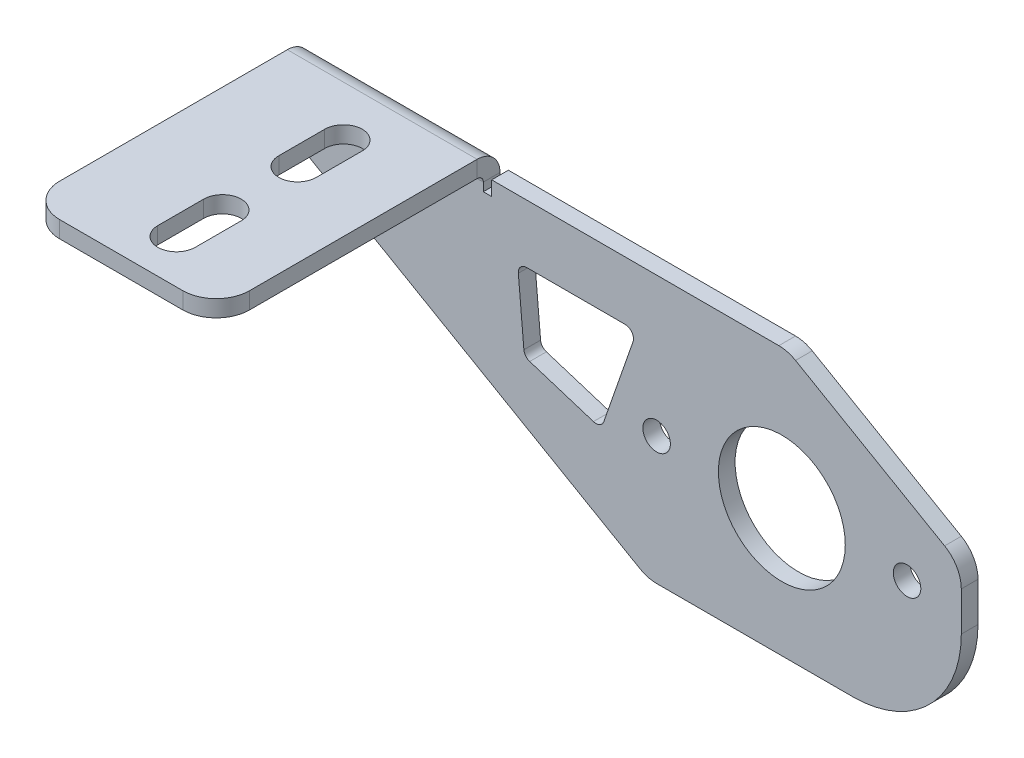
from build123d import *

# Parameters (mm, degrees)
SM_BASE_FLANGE_1_DEPTH            = 2
SKETCH_6_R                        = 7.6
SKETCH_6_R_2                      = 1.65
CUT_EXTRUDE_1_DEPTH               = 10
SM_EDGE_FLANGE_1_STRIP_W          = 9.4732
SM_EDGE_FLANGE_1_STRIP_H          = 2
SM_EDGE_FLANGE_1_STRIP_CUT_DEPTH  = 22.74
SM_EDGE_FLANGE_1_RELIEF_W         = 10.4732
SM_EDGE_FLANGE_1_RELIEF_H         = 1
SM_EDGE_FLANGE_1_RELIEF_CUT_DEPTH = 2
SM_EDGE_FLANGE_1_DEPTH            = 22.74
CUT_EXTRUDE_2_DEPTH               = 10
FILLET_1_R                        = 4
CUT_EXTRUDE_3_DEPTH               = 10
FILLET_2_R                        = 1
FILLET_3_R                        = 13


# Sheet-metal steps are written as plain solids
with BuildPart() as part:
    # Sketch 1 → 基体-法兰1 (new body)
    with BuildSketch(Plane.XY):
        Polygon((0, 0), (0, -7.5), (42.435244785, -32), (80, -32), (80, -12), (59.215390309, 0), align=None)
    extrude(amount=-SM_BASE_FLANGE_1_DEPTH)

    # 草图6 → 切除-拉伸1 (cut)
    with BuildSketch(Plane.XY):
        with Locations((58.5, -16.7)):
            Circle(SKETCH_6_R)
        with Locations((73.5, -16.7)):
            Circle(SKETCH_6_R_2)
        with Locations((43.5, -16.7)):
            Circle(SKETCH_6_R_2)
    extrude(amount=-CUT_EXTRUDE_1_DEPTH, mode=Mode.SUBTRACT)

    # 边线-法兰1 strip (across the edge) → 边线-法兰1 strip cut (cut)
    with BuildSketch(Plane(origin=(22.74, 0, 0), x_dir=(0, -1, 0), z_dir=(-1, 0, 0))):
        with Locations((-4, -1)):
            Rectangle(SM_EDGE_FLANGE_1_STRIP_W, SM_EDGE_FLANGE_1_STRIP_H)
    extrude(amount=SM_EDGE_FLANGE_1_STRIP_CUT_DEPTH, mode=Mode.SUBTRACT)

    # 边线-法兰1 relief (on the sheet) → 边线-法兰1 relief cut (cut)
    with BuildSketch(Plane(origin=(22.74, -0.7366, 0), x_dir=(0, -1, 0), z_dir=(0, 0, 1))):
        with Locations((-4.2366, 0.5)):
            Rectangle(SM_EDGE_FLANGE_1_RELIEF_W, SM_EDGE_FLANGE_1_RELIEF_H)
    extrude(amount=-SM_EDGE_FLANGE_1_RELIEF_CUT_DEPTH, mode=Mode.SUBTRACT)

    # 边线-法兰1 section (across the edge) → 边线-法兰1 (add)
    with BuildSketch(Plane(origin=(22.74, 0, 0), x_dir=(0, -1, 0), z_dir=(-1, 0, 0))):
        with BuildLine():
            Line((-2, 0.7366), (-2, 32))
            Line((-2, 32), (0, 32))
            Line((0, 32), (0, 0.7366))
            ThreePointArc((0, 0.7366), (0.215745145, 0.215745145), (0.7366, 0))
            Line((0.7366, 0), (0.7366, -2))
            ThreePointArc((0.7366, -2), (-1.198468417, -1.198468417), (-2, 0.7366))
        make_face()
    extrude(amount=SM_EDGE_FLANGE_1_DEPTH)

    # 草图12 → 切除-拉伸2 (cut)
    with BuildSketch(Plane(origin=(0, 2, 0), x_dir=(1, 0, 0), z_dir=(0, 1, 0))):
        with BuildLine():
            Line((10.49, -26.75), (10.49, -21.25))
            ThreePointArc((10.49, -21.25), (12.74, -19), (14.99, -21.25))
            Line((14.99, -21.25), (14.99, -26.75))
            ThreePointArc((14.99, -26.75), (12.74, -29), (10.49, -26.75))
        make_face()
        with BuildLine():
            Line((10.49, -12.25), (10.49, -6.75))
            ThreePointArc((10.49, -6.75), (12.74, -4.5), (14.99, -6.75))
            Line((14.99, -6.75), (14.99, -12.25))
            ThreePointArc((14.99, -12.25), (12.74, -14.5), (10.49, -12.25))
        make_face()
    extrude(amount=-CUT_EXTRUDE_2_DEPTH, mode=Mode.SUBTRACT)

    # 圆角1
    fillet_1_edges = [part.edges().sort_by_distance(p)[0] for p in [
        (59.215390309, 0, -1),
        (80, -12, -1),
        (42.435244785, -32, -1),
        (0, -7.5, -1),
        (22.74, 1, 32),
        (0, 1, 32),
    ]]
    fillet(fillet_1_edges, radius=FILLET_1_R)

    # 草图14 → 切除-拉伸3 (cut)
    with BuildSketch(Plane(origin=(0, 0, -2), x_dir=(-1, 0, 0), z_dir=(0, 0, -1))):
        Polygon((-36.859263982, -19.274986727), (-27.659263982, -16.364230162), (-26.84, -7), (-41.14, -7), align=None)
    extrude(amount=-CUT_EXTRUDE_3_DEPTH, mode=Mode.SUBTRACT)

    # 圆角2
    fillet_2_edges = [part.edges().sort_by_distance(p)[0] for p in [
        (26.84, -7, -1),
        (27.659263982, -16.364230162, -1),
        (36.859263982, -19.274986727, -1),
        (41.14, -7, -1),
    ]]
    fillet(fillet_2_edges, radius=FILLET_2_R)

    # 圆角3
    fillet_3_edges = [part.edges().sort_by_distance(p)[0] for p in [
        (80, -32, -1),
    ]]
    fillet(fillet_3_edges, radius=FILLET_3_R)


solid = part.part
